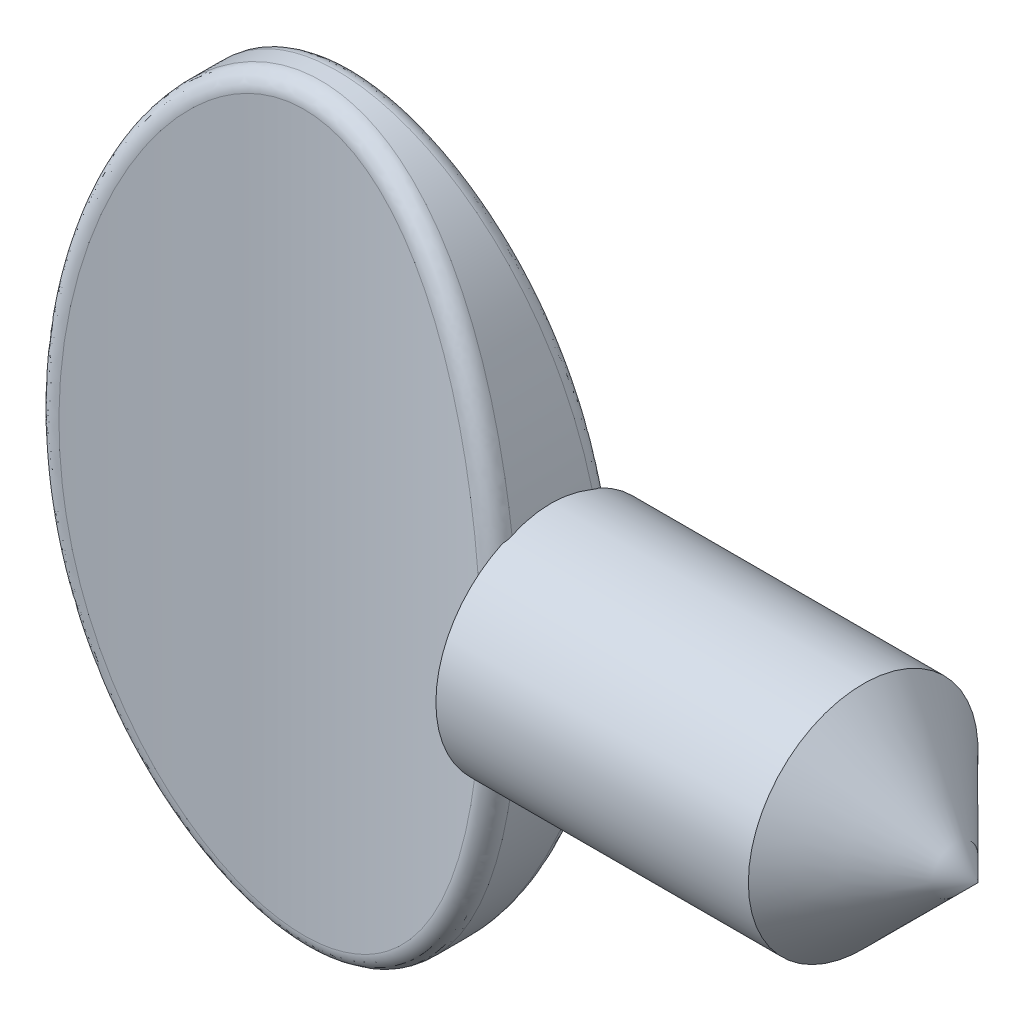
from build123d import *

# Parameters (mm, degrees)
SKETCH1_RX              = 5.715
SKETCH1_RY              = 3.556
EXTRUDE1_DEPTH          = 1.016
CUT_EXTRUDE1_DEPTH      = 7.8072473878947575
CUT_EXTRUDE1_DEPTH_BACK = 7.8072473878947575
SKETCH2_OUTSIDE_W       = 11.834000000000001
SKETCH2_OUTSIDE_H       = 6.754
FILLET3_R               = 0.254


with BuildPart() as part:
    # Sketch1 → Extrude1 (new, symmetric)
    with BuildSketch(Plane.XY):
        with Locations(Location((0, 0), (0, 0, -90))):
            Ellipse(SKETCH1_RX, SKETCH1_RY)
    extrude(amount=EXTRUDE1_DEPTH, both=True)

    # Sketch2 outside → Cut-Extrude1 (cut, two sides: drawn at the far end of the back side and taken through both)
    with BuildSketch(Plane(origin=(0, 0, 0), x_dir=(1, 0, 0), z_dir=(0, 1, 0)).offset(-CUT_EXTRUDE1_DEPTH_BACK)):
        Rectangle(SKETCH2_OUTSIDE_W, SKETCH2_OUTSIDE_H)
        with BuildLine():
            Line((-3.556, 1.016), (-3.556, -1.016))
            ThreePointArc((-3.556, -1.016), (6.3e-16, -0.3810000000000002), (3.556, -1.016))
            Line((3.556, -1.016), (3.556, 1.016))
            ThreePointArc((3.556, 1.016), (6.3e-16, 0.3810000000000002), (-3.556, 1.016))
        make_face(mode=Mode.SUBTRACT)
    extrude(amount=CUT_EXTRUDE1_DEPTH + CUT_EXTRUDE1_DEPTH_BACK, mode=Mode.SUBTRACT)

    # Fillet3
    fillet3_edges = [part.edges().sort_by_distance(p)[0] for p in [
        (-2.772297743363364, -3.579097133488567, 0.7620899166368158),
        (6.761380256e-08, 5.714999999994567, -0.38099999999467776),
    ]]
    fillet(fillet3_edges, radius=FILLET3_R)

    # Sketch3 → Revolve1 (revolve)
    with BuildSketch(Plane(origin=(0, 0, 0), x_dir=(1, 0, 0), z_dir=(0, 1, 0))):
        with BuildLine():
            Line((9.906, 0), (8.15339999999998, 1.7525999999999997))
            Line((8.15339999999998, 1.7525999999999997), (4.741333333333333, 1.7526))
            Line((4.741333333333333, 1.7526), (3.3846611661960426, 1.7526000000000004))
            ThreePointArc((3.3846611661960426, 1.7526000000000004), (3.1592934071520324, 1.093146291526699), (2.577464628985661, 0.7095513315322604))
            Line((2.577464628985661, 0.7095513315322604), (2.577464628985661, 1e-17))
            Line((2.577464628985661, 1e-17), (9.906, 0))
        make_face()
    revolve(axis=Axis((0, 0, 0), (1, 0, 0)))


solid = part.part
